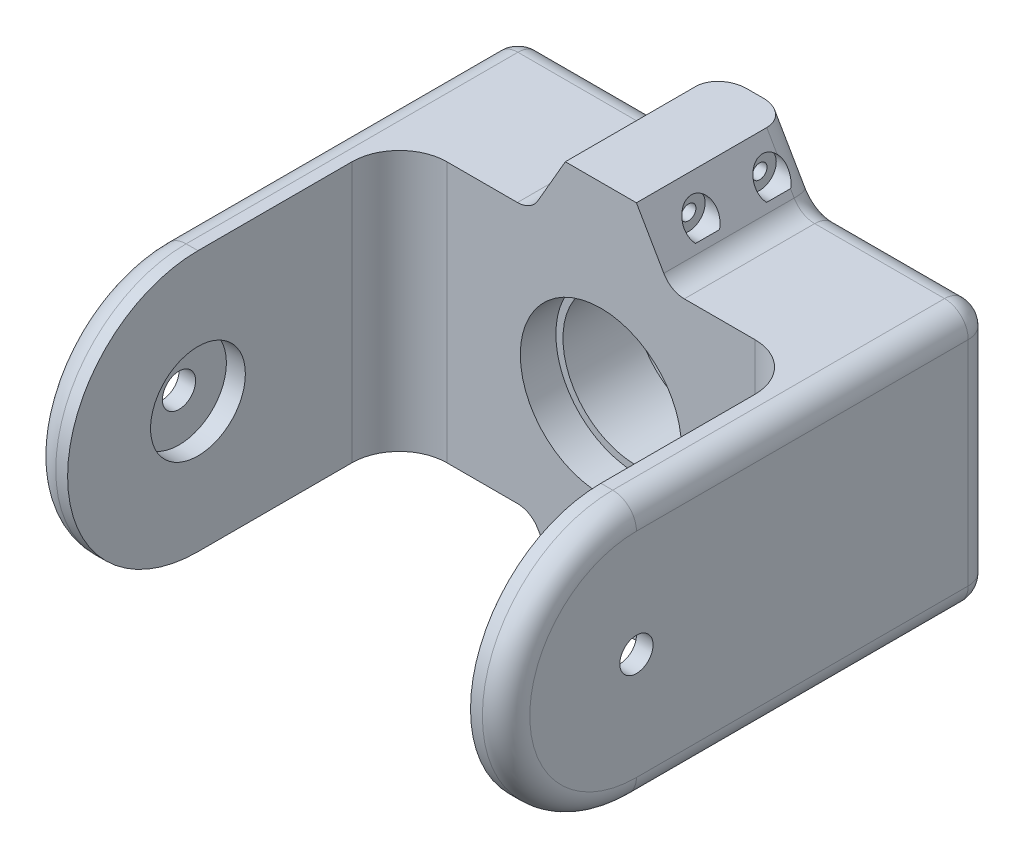
from build123d import *

# Parameters (mm, degrees)
SKETCH1_R                 = 34
SKETCH1_R_2               = 31
CENTRE_HOLE_FOR_L2_DEPTH  = 30
MAIN_STRUCTURE_DEPTH      = 100
MAIN_STRUCTURE_DEPTH_BACK = 50
SKETCH2_W                 = 200
SKETCH2_H                 = 110
SKETCH2_R                 = 34
BEARING_CURVE_DEPTH       = 15
SKETCH6_R                 = 7
CUT_EXTRUDE2_DEPTH        = 15
WRIST_CUTOUT_DEPTH        = 238.328885726
SKETCH9_R                 = 20
CUT_EXTRUDE3_DEPTH        = 8
FILLET2_R                 = 10
BOSS_EXTRUDE4_DEPTH       = 65
SKETCH11_R                = 3.1
CUT_EXTRUDE6_DEPTH        = 226
CUT_EXTRUDE8_START        = 17
CUT_EXTRUDE8_OUTLINE_R    = 7
CUT_EXTRUDE8_OUTLINE_R_2  = 3.1
CUT_EXTRUDE8_DEPTH        = 8
FILLET3_R                 = 10
FILLET1_R                 = 10


# Read off the part's stored shape, not the designer's step: Cut-Extrude8
with BuildPart() as part:
    # Sketch1 → Centre Hole for L2 (new body)
    with BuildSketch(Plane.XY):
        Circle(SKETCH1_R)
        Circle(SKETCH1_R_2, mode=Mode.SUBTRACT)
    extrude(amount=CENTRE_HOLE_FOR_L2_DEPTH)


with BuildPart() as body_2:
    # Sketch2 → Main Structure (new, two sides: drawn at the far end of the back side and taken through both)
    with BuildSketch(Plane.XY.offset(30).offset(-MAIN_STRUCTURE_DEPTH_BACK)):
        Rectangle(SKETCH2_W, SKETCH2_H)
        Circle(SKETCH2_R, mode=Mode.SUBTRACT)
    extrude(amount=MAIN_STRUCTURE_DEPTH + MAIN_STRUCTURE_DEPTH_BACK)

    # Sketch3 → Bearing Curve (add)
    with BuildSketch(Plane.ZY.offset(100)):
        with BuildLine():
            Line((130, 55), (130, -55))
            ThreePointArc((130, -55), (185, 0), (130, 55))
        make_face()
    bearing_curve = extrude(amount=-BEARING_CURVE_DEPTH)

    # Mirror7: Bearing Curve across plane
    add(bearing_curve.mirror(Plane(origin=(0, 0, 0), x_dir=(0, 0, 1), z_dir=(1, 0, 0))))

    # Sketch6 → Cut-Extrude2 (cut)
    with BuildSketch(Plane.ZY.offset(100)):
        with Locations((130, 0)):
            Circle(SKETCH6_R)
    cut_extrude2 = extrude(amount=-CUT_EXTRUDE2_DEPTH, mode=Mode.SUBTRACT)

    # Sketch4 → Wrist Cutout (cut, through all)
    with BuildSketch(Plane(origin=(0, 55, 0), x_dir=(1, 0, 0), z_dir=(0, 1, 0))):
        with BuildLine():
            Line((-85, -130), (-85, -65))
            ThreePointArc((-85, -65), (-79.142135624, -50.857864376), (-65, -45))
            Line((-65, -45), (65, -45))
            ThreePointArc((65, -45), (79.142135624, -50.857864376), (85, -65))
            Line((85, -65), (85, -130))
            Line((85, -130), (-85, -130))
        make_face()
    extrude(amount=-WRIST_CUTOUT_DEPTH, mode=Mode.SUBTRACT)

    # Sketch9 → Cut-Extrude3 (cut)
    with BuildSketch(Plane(origin=(-85, 0, 0), x_dir=(0, 0, -1), z_dir=(1, 0, 0))):
        with Locations((-130, 0)):
            Circle(SKETCH9_R)
    cut_extrude3 = extrude(amount=-CUT_EXTRUDE3_DEPTH, mode=Mode.SUBTRACT)

    # Mirror6: Cut-Extrude2, Cut-Extrude3 across plane
    add(cut_extrude2.mirror(Plane(origin=(0, 0, 0), x_dir=(0, 0, 1), z_dir=(1, 0, 0))), mode=Mode.SUBTRACT)
    add(cut_extrude3.mirror(Plane(origin=(0, 0, 0), x_dir=(0, 0, 1), z_dir=(1, 0, 0))), mode=Mode.SUBTRACT)

    # Fillet2
    fillet2_edges = [body_2.edges().sort_by_distance(p)[0] for p in [
        (-100, 0, -20),
        (100, 0, -20),
    ]]
    fillet(fillet2_edges, radius=FILLET2_R)

    # Sketch10 → Boss-Extrude4 (add)
    with BuildSketch(Plane(origin=(0, 0, -20), x_dir=(-1, 0, 0), z_dir=(0, 0, -1))):
        Polygon((15, 80), (-15, 80), (-29.43375673, 55), (29.43375673, 55), align=None)
    boss_extrude4 = extrude(amount=-BOSS_EXTRUDE4_DEPTH)

    # Sketch11 → Cut-Extrude6 (cut, symmetric)
    with BuildSketch(Plane(origin=(0, 0, 0), x_dir=(0, 0, -1), z_dir=(1, 0, 0))):
        with Locations(Location((5, 67.5, 0), (0, 0, 90))):
            Circle(SKETCH11_R)
        with Locations(Location((-25, 67.5, 0), (0, 0, 90))):
            Circle(SKETCH11_R)
    cut_extrude6 = extrude(amount=CUT_EXTRUDE6_DEPTH, both=True, mode=Mode.SUBTRACT)

    # Cut-Extrude8 outline → Cut-Extrude8 (cut)
    # profile 1 of 2: a face of its own
    with BuildSketch(Plane(origin=(0, 0, 0), x_dir=(0, 0, -1), z_dir=(1, 0, 0)).offset(CUT_EXTRUDE8_START)):
        with Locations((5, 67.5)):
            Circle(CUT_EXTRUDE8_OUTLINE_R)
        with Locations((5, 67.5)):
            Circle(CUT_EXTRUDE8_OUTLINE_R_2, mode=Mode.SUBTRACT)
    # profile 2 of 2: a face of its own
    with BuildSketch(Plane(origin=(0, 0, 0), x_dir=(0, 0, -1), z_dir=(1, 0, 0)).offset(CUT_EXTRUDE8_START)):
        with Locations((-25, 67.5)):
            Circle(CUT_EXTRUDE8_OUTLINE_R)
        with Locations((-25, 67.5)):
            Circle(CUT_EXTRUDE8_OUTLINE_R_2, mode=Mode.SUBTRACT)
    cut_extrude8 = extrude(amount=CUT_EXTRUDE8_DEPTH, mode=Mode.SUBTRACT)

    # Mirror8: Boss-Extrude4, Cut-Extrude6, Cut-Extrude8 across plane
    add(boss_extrude4.mirror(Plane.ZX))
    add(cut_extrude6.mirror(Plane.ZX), mode=Mode.SUBTRACT)
    add(cut_extrude8.mirror(Plane.ZX), mode=Mode.SUBTRACT)

    # Fillet3
    fillet3_edges = [body_2.edges().sort_by_distance(p)[0] for p in [
        (-29.43375673, 55, 12.5),
        (29.43375673, 55, 12.5),
        (29.43375673, -55, 12.5),
        (-29.43375673, -55, 12.5),
    ]]
    fillet(fillet3_edges, radius=FILLET3_R)

    # Fillet1
    # the kernel refuses this fillet: 10 mm, written as the material it takes off along each edge
    with BuildSketch(Plane(origin=(-100, 55, 130), x_dir=(1, 0, 0), z_dir=(0, 0, -1)), Plane(origin=(-100, -55, -10), x_dir=(1, 0, 0), z_dir=(0, 0, 1))) as fillet1_piece_1:
        with BuildLine():
            CenterArc((FILLET1_R, FILLET1_R), FILLET1_R, 180, 90)
            Line((0, FILLET1_R), (0, 0))
            Line((0, 0), (FILLET1_R, 0))
        make_face()
    extrude(amount=140, mode=Mode.SUBTRACT)
    with BuildSketch(Plane(origin=(100, -55, -10), x_dir=(-1, 0, 0), z_dir=(0, 0, 1)), Plane(origin=(100, 55, 130), x_dir=(-1, 0, 0), z_dir=(0, 0, -1))) as fillet1_piece_2:
        with BuildLine():
            CenterArc((FILLET1_R, -FILLET1_R), FILLET1_R, 90, 90)
            Line((0, -FILLET1_R), (0, 0))
            Line((0, 0), (FILLET1_R, 0))
        make_face()
    extrude(amount=140, mode=Mode.SUBTRACT)
    with BuildSketch(Plane(origin=(-100, 0, 130), x_dir=(0, -1, 0), z_dir=(0, 0, -1))) as fillet1_piece_3:
        with BuildLine():
            CenterArc((55 - FILLET1_R, -FILLET1_R), FILLET1_R, 0, 90)
            Line((55, -FILLET1_R), (55, 0))
            Line((55, 0), (55 - FILLET1_R, 0))
        make_face()
    revolve(axis=Axis((-100, 0, 130), (-1, 0, 0)), revolution_arc=180, mode=Mode.SUBTRACT)
    with BuildSketch(Plane(origin=(-26.547005384, -60, -20), x_dir=(0, 0, 1), z_dir=(0.5000000000000004, -0.8660254037844384, 0)), Plane(origin=(2.5, -101.650635095, -20), x_dir=(0, 0, 1), z_dir=(0.4999999999999977, 0.86602540378444, 0))) as fillet1_piece_4:
        with BuildLine():
            CenterArc((FILLET1_R, -FILLET1_R), FILLET1_R, 90, 90)
            Line((0, -FILLET1_R), (0, 0))
            Line((0, 0), (FILLET1_R, 0))
        make_face()
    extrude(amount=48.094010768, mode=Mode.SUBTRACT)
    with BuildSketch(Plane(origin=(-35.207259422, -65, -20), x_dir=(0.8660254037844382, 0.5000000000000007, 0), z_dir=(0.5000000000000007, -0.8660254037844382, 0))) as fillet1_piece_5:
        with BuildLine():
            CenterArc((10 + FILLET1_R, FILLET1_R), FILLET1_R, 180, 90)
            Line((10 + FILLET1_R, 0), (10, 0))
            Line((10, 0), (10, FILLET1_R))
        make_face()
    revolve(axis=Axis((-35.207259422, -65, -20), (0, 0, 1)), revolution_arc=60, mode=Mode.SUBTRACT)
    with BuildSketch(Plane(origin=(-90, -55, -20), x_dir=(0, 0, 1), z_dir=(1, 0, 0)), Plane(origin=(-35.207259422, 55, -20), x_dir=(0, 0, 1), z_dir=(-1, 0, 0)), Plane(origin=(90, 55, -20), x_dir=(0, 0, 1), z_dir=(-1, 0, 0)), Plane(origin=(35.207259422, -55, -20), x_dir=(0, 0, 1), z_dir=(1, 0, 0))) as fillet1_piece_6:
        with BuildLine():
            CenterArc((FILLET1_R, -FILLET1_R), FILLET1_R, 90, 90)
            Line((0, -FILLET1_R), (0, 0))
            Line((0, 0), (FILLET1_R, 0))
        make_face()
    extrude(amount=54.792740578, mode=Mode.SUBTRACT)
    with BuildSketch(Plane(origin=(-90, -55, -10), x_dir=(-1, 0, 0), z_dir=(0, 0, 1))) as fillet1_piece_7:
        with BuildLine():
            CenterArc((10 - FILLET1_R, -FILLET1_R), FILLET1_R, 0, 90)
            Line((10, -FILLET1_R), (10, 0))
            Line((10, 0), (10 - FILLET1_R, 0))
        make_face()
    revolve(axis=Axis((-90, -55, -10), (0, -1, 0)), revolution_arc=90, mode=Mode.SUBTRACT)
    with BuildSketch(Plane(origin=(-26.547005384, 60, -20), x_dir=(0, 0, 1), z_dir=(0.5000000000000004, 0.8660254037844384, 0)), Plane(origin=(2.5, 101.650635095, -20), x_dir=(0, 0, 1), z_dir=(0.4999999999999977, -0.86602540378444, 0))) as fillet1_piece_8:
        with BuildLine():
            CenterArc((FILLET1_R, FILLET1_R), FILLET1_R, 180, 90)
            Line((0, FILLET1_R), (0, 0))
            Line((0, 0), (FILLET1_R, 0))
        make_face()
    extrude(amount=48.094010768, mode=Mode.SUBTRACT)
    with BuildSketch(Plane(origin=(-35.207259422, 65, -20), x_dir=(0.8660254037844386, -0.5, 0), z_dir=(0.5, 0.8660254037844386, 0))) as fillet1_piece_9:
        with BuildLine():
            CenterArc((10 + FILLET1_R, -FILLET1_R), FILLET1_R, 90, 90)
            Line((10 + FILLET1_R, 0), (10, 0))
            Line((10, 0), (10, -FILLET1_R))
        make_face()
    revolve(axis=Axis((-35.207259422, 65, -20), (0, 0, -1)), revolution_arc=60, mode=Mode.SUBTRACT)
    with BuildSketch(Plane(origin=(-90, 55, -10), x_dir=(-1, 0, 0), z_dir=(0, 0, 1))) as fillet1_piece_10:
        with BuildLine():
            CenterArc((10 - FILLET1_R, FILLET1_R), FILLET1_R, 270, 90)
            Line((10, FILLET1_R), (10, 0))
            Line((10, 0), (10 - FILLET1_R, 0))
        make_face()
    revolve(axis=Axis((-90, 55, -10), (0, -1, 0)), revolution_arc=90, mode=Mode.SUBTRACT)
    with BuildSketch(Plane(origin=(35.207259422, 65, -20), x_dir=(-0.8660254037844404, -0.49999999999999717, 0), z_dir=(-0.49999999999999717, 0.8660254037844404, 0))) as fillet1_piece_11:
        with BuildLine():
            CenterArc((10 + FILLET1_R, FILLET1_R), FILLET1_R, 180, 90)
            Line((10 + FILLET1_R, 0), (10, 0))
            Line((10, 0), (10, FILLET1_R))
        make_face()
    revolve(axis=Axis((35.207259422, 65, -20), (0, 0, 1)), revolution_arc=60, mode=Mode.SUBTRACT)
    with BuildSketch(Plane(origin=(90, 55, -10), x_dir=(0, 0, -1), z_dir=(-1, 0, 0))) as fillet1_piece_12:
        with BuildLine():
            CenterArc((10 - FILLET1_R, FILLET1_R), FILLET1_R, 270, 90)
            Line((10, FILLET1_R), (10, 0))
            Line((10, 0), (10 - FILLET1_R, 0))
        make_face()
    revolve(axis=Axis((90, 55, -10), (0, -1, 0)), revolution_arc=90, mode=Mode.SUBTRACT)
    with BuildSketch(Plane(origin=(35.207259422, -65, -20), x_dir=(0, 1, 0), z_dir=(1, 0, 0))) as fillet1_piece_13:
        with BuildLine():
            CenterArc((10 + FILLET1_R, FILLET1_R), FILLET1_R, 180, 90)
            Line((10 + FILLET1_R, 0), (10, 0))
            Line((10, 0), (10, FILLET1_R))
        make_face()
    revolve(axis=Axis((35.207259422, -65, -20), (0, 0, 1)), revolution_arc=60, mode=Mode.SUBTRACT)
    with BuildSketch(Plane(origin=(90, -55, -10), x_dir=(0, 0, -1), z_dir=(-1, 0, 0))) as fillet1_piece_14:
        with BuildLine():
            CenterArc((10 - FILLET1_R, -FILLET1_R), FILLET1_R, 0, 90)
            Line((10, -FILLET1_R), (10, 0))
            Line((10, 0), (10 - FILLET1_R, 0))
        make_face()
    revolve(axis=Axis((90, -55, -10), (0, -1, 0)), revolution_arc=90, mode=Mode.SUBTRACT)
    with BuildSketch(Plane(origin=(100, 0, 130), x_dir=(0, -1, 0), z_dir=(0, 0, -1))) as fillet1_piece_15:
        with BuildLine():
            CenterArc((55 - FILLET1_R, FILLET1_R), FILLET1_R, 270, 90)
            Line((55, FILLET1_R), (55, 0))
            Line((55, 0), (55 - FILLET1_R, 0))
        make_face()
    revolve(axis=Axis((100, 0, 130), (-1, 0, 0)), revolution_arc=180, mode=Mode.SUBTRACT)


solid = Compound([part.part, body_2.part])
